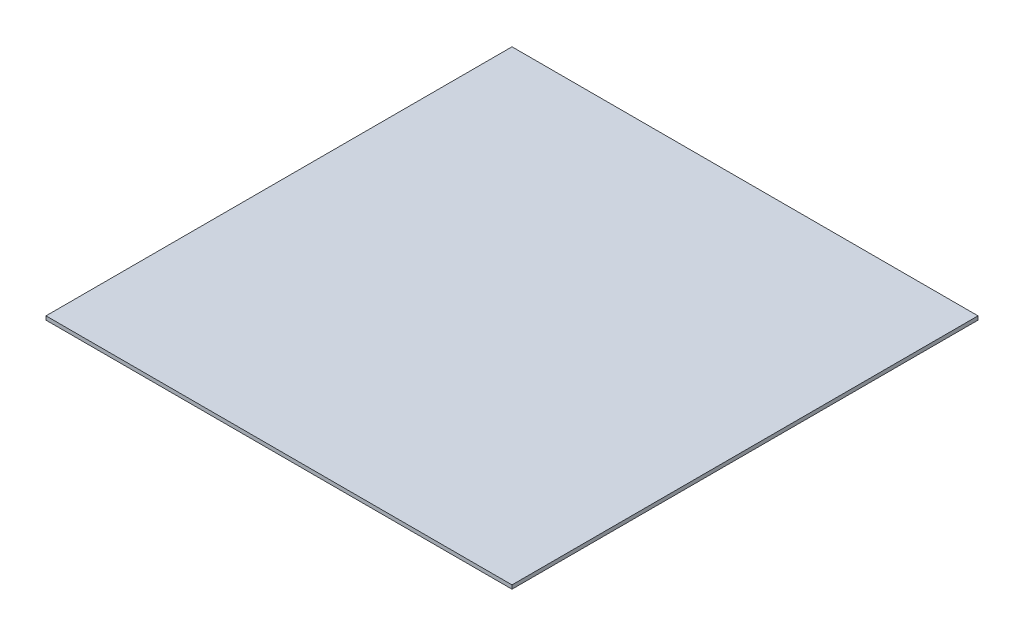
from build123d import *

# Parameters (mm, degrees)
SKETCH1_W           = 393.7
SKETCH1_H           = 393.7
BOSS_EXTRUDE1_DEPTH = 3.175


with BuildPart() as part:
    # Sketch1 → Boss-Extrude1 (new body)
    with BuildSketch(Plane(origin=(0, 0, 0), x_dir=(1, 0, 0), z_dir=(0, 1, 0))):
        Rectangle(SKETCH1_W, SKETCH1_H)
    extrude(amount=BOSS_EXTRUDE1_DEPTH)


solid = part.part
